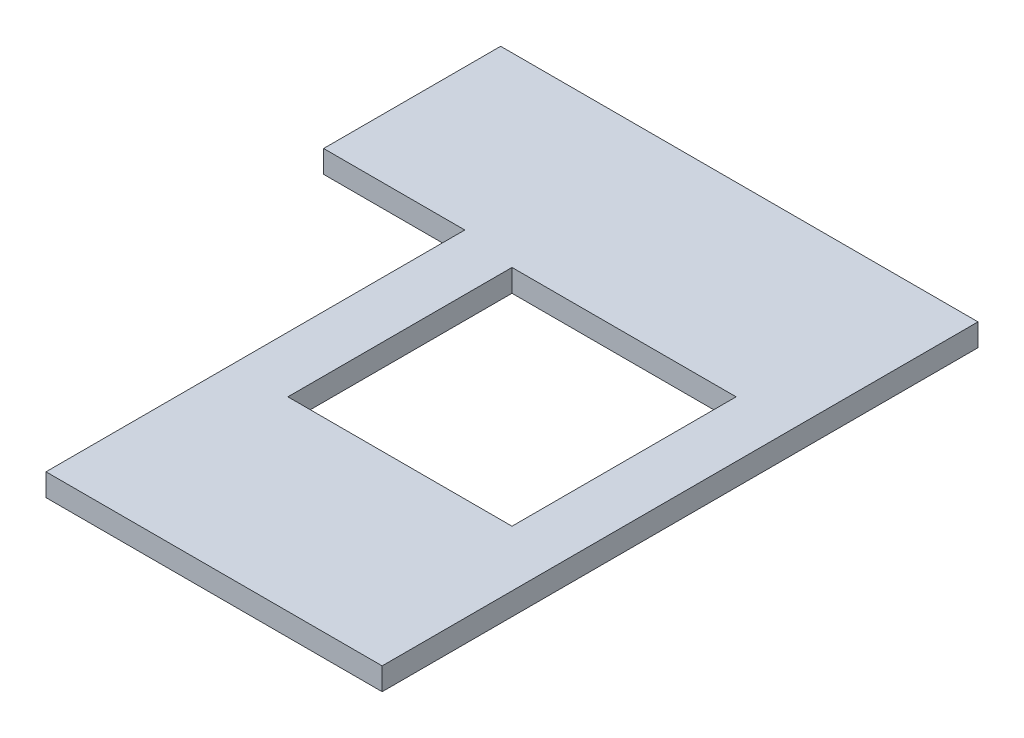
from build123d import *

# Parameters (mm, degrees)
SKETCH1_W           = 150
SKETCH1_H           = 30
BOSS_EXTRUDE1_DEPTH = 10
SKETCH9_W           = 150
SKETCH9_H           = 265.88
SKETCH9_W_2         = 100
SKETCH9_H_2         = 100
BOSS_EXTRUDE3_DEPTH = 10
SKETCH25_W          = 150
SKETCH25_H          = 30
CUT_EXTRUDE2_DEPTH  = 10
SKETCH26_W          = 79
SKETCH26_H          = 10
BOSS_EXTRUDE4_DEPTH = 63


with BuildPart() as part:
    # Sketch1 → Boss-Extrude1 (new body)
    with BuildSketch(Plane(origin=(0, 0, 0), x_dir=(1, 0, 0), z_dir=(0, 1, 0))):
        with Locations((-75, 15)):
            Rectangle(SKETCH1_W, SKETCH1_H)
    extrude(amount=BOSS_EXTRUDE1_DEPTH)

    # Sketch9 → Boss-Extrude3 (add)
    with BuildSketch(Plane.XZ):
        with Locations((-75, -15)):
            Rectangle(SKETCH9_W, SKETCH9_H)
        with Locations((-75, -15)):
            Rectangle(SKETCH9_W_2, SKETCH9_H_2, mode=Mode.SUBTRACT)
    extrude(amount=BOSS_EXTRUDE3_DEPTH)

    # Sketch25 → Cut-Extrude2 (cut)
    with BuildSketch(Plane(origin=(0, 0, 0), x_dir=(1, 0, 0), z_dir=(0, 1, 0))):
        with Locations((-75, 15)):
            Rectangle(SKETCH25_W, SKETCH25_H)
    extrude(amount=CUT_EXTRUDE2_DEPTH, mode=Mode.SUBTRACT)

    # Sketch26 → Boss-Extrude4 (add)
    with BuildSketch(Plane.ZY.offset(150)):
        with Locations((-108.44, -5)):
            Rectangle(SKETCH26_W, SKETCH26_H)
    extrude(amount=BOSS_EXTRUDE4_DEPTH)


solid = part.part
